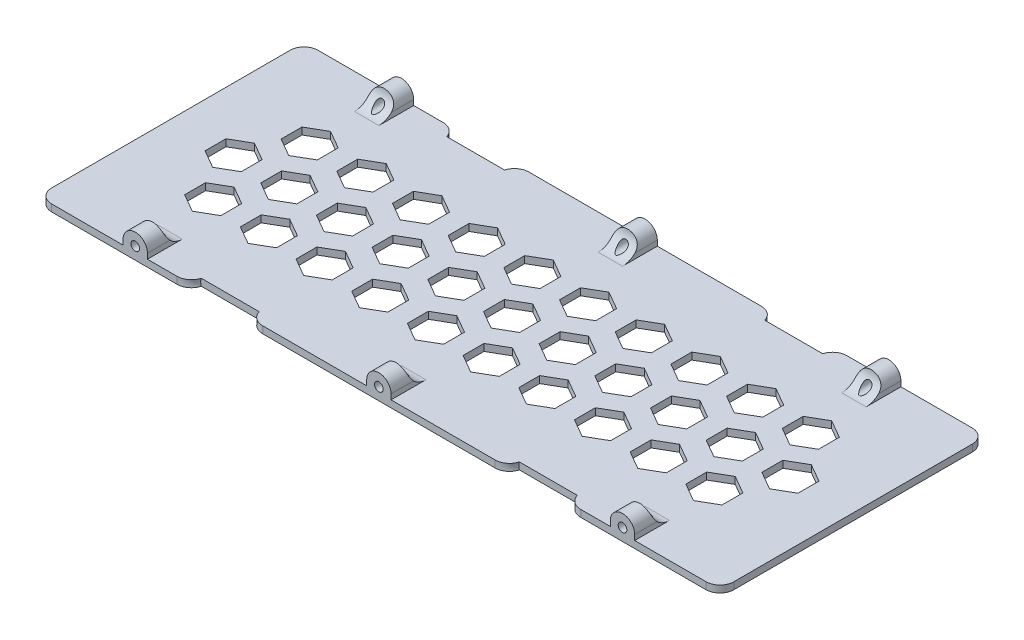
from build123d import *

# Parameters (mm, degrees)
ESQUISSE1_W                                   = 196
ESQUISSE1_H                                   = 76.5
BOSS_EXTRU_1_DEPTH                            = 2
BOSS_EXTRU_2_DEPTH                            = 5
CONG_1_R                                      = 5
TROU_POUR_TARAUDAGE_POUR_TROU_TARAUD_M3_D     = 2.5
TROU_POUR_TARAUDAGE_POUR_TROU_TARAUD_M3_DEPTH = 10.001
R_P_TITION_START                              = 33.250000679
R_P_TITION_LIN_AIRE1_OUTLINE_R                = 1.25
R_P_TITION_LIN_AIRE1_DEPTH                    = 4.999999321
R_P_TITION_START_2                            = 28.2499999
R_P_TITION_LIN_AIRE1_2_OUTLINE_R              = 1.25
R_P_TITION_LIN_AIRE1_2_DEPTH                  = 5.000000779
R_P_TITION_LIN_AIRE1_3_OUTLINE_W              = 5
R_P_TITION_LIN_AIRE1_3_OUTLINE_H              = 7.00000097
ENL_V_MAT_EXTRU_1_DEPTH                       = 3
SYM_TRIE1_START                               = -38.25
SYM_TRIE1_DEPTH                               = 3
SYM_TRIE1_2_OUTLINE_R                         = 1.25
SYM_TRIE1_2_DEPTH                             = 4.999999321
SYM_TRIE1_START_2                             = -33.250000679
SYM_TRIE1_3_OUTLINE_R                         = 1.25
SYM_TRIE1_3_DEPTH                             = 5.000000679
SYM_TRIE1_4_OUTLINE_W                         = 5
SYM_TRIE1_4_OUTLINE_H                         = 7.00000097
CONG_3_R                                      = 4
R_P_TITION_DANS_UNE_ZONE2_DEPTH               = 2


with BuildPart() as part:
    # Esquisse1 → Boss.-Extru.1 (new body)
    with BuildSketch(Plane(origin=(0, 0, 0), x_dir=(1, 0, 0), z_dir=(0, 1, 0))):
        Rectangle(ESQUISSE1_W, ESQUISSE1_H)
    extrude(amount=BOSS_EXTRU_1_DEPTH)

    # Esquisse2 → Boss.-Extru.2 (add)
    with BuildSketch(Plane.XY.offset(38.25)):
        with BuildLine():
            Line((-3.5, 2), (-3.5, 3.5))
            ThreePointArc((-3.5, 3.5), (0, 7), (3.5, 3.5))
            Line((3.5, 3.5), (3.5, 2))
            Line((3.5, 2), (-3.5, 2))
        make_face()
    extrude(amount=-BOSS_EXTRU_2_DEPTH)

    # Congé1
    cong_1_edges = [part.edges().sort_by_distance(p)[0] for p in [
        (0, 2, 33.25),
    ]]
    fillet(cong_1_edges, radius=CONG_1_R - 0.0001)  # a hair under: the kernel refuses the full size

    # Trou pour taraudage pour trou taraudé M3x0.51
    with Locations(Plane(origin=(0, 3.5, 38.25), x_dir=(1, 0, 0), z_dir=(0, 0, 1))):
        with Locations((0, 0)):
            Hole(TROU_POUR_TARAUDAGE_POUR_TROU_TARAUD_M3_D / 2, depth=TROU_POUR_TARAUDAGE_POUR_TROU_TARAUD_M3_DEPTH)

    # Répétition linéaire1: read off the stored shape, not the designer's step
    # Répétition linéaire1 outline → Répétition linéaire1 (add)
    # profile 1 of 2: a face of its own
    with BuildSketch(Plane.XY.offset(R_P_TITION_START)):
        with BuildLine():
            ThreePointArc((-66.5, 3.5), (-70, 7), (-73.5, 3.5))
            Line((-73.5, 3.5), (-73.5, 2))
            Line((-73.5, 2), (-66.5, 2))
            Line((-66.5, 2), (-66.5, 3.5))
        make_face()
        with Locations((-70, 3.5)):
            Circle(R_P_TITION_LIN_AIRE1_OUTLINE_R, mode=Mode.SUBTRACT)
    # profile 2 of 2: a face of its own
    with BuildSketch(Plane.XY.offset(R_P_TITION_START)):
        with BuildLine():
            Line((66.5, 3.5), (66.5, 2))
            Line((66.5, 2), (73.5, 2))
            Line((73.5, 2), (73.5, 3.5))
            ThreePointArc((73.5, 3.5), (70, 7), (66.5, 3.5))
        make_face()
        with Locations((70, 3.5)):
            Circle(R_P_TITION_LIN_AIRE1_OUTLINE_R, mode=Mode.SUBTRACT)
    extrude(amount=R_P_TITION_LIN_AIRE1_DEPTH)

    # R_p_tition lin_aire1 2 outline → R_p_tition lin_aire1 2 (add)
    # profile 1 of 2: a face of its own
    with BuildSketch(Plane.XY.offset(R_P_TITION_START_2)):
        with BuildLine():
            ThreePointArc((-66.5, 3.5), (-70, 7), (-73.5, 3.5))
            Line((-73.5, 3.5), (-73.5, 2))
            Line((-73.5, 2), (-66.5, 2))
            Line((-66.5, 2), (-66.5, 3.5))
        make_face()
        with Locations((-70, 3.5)):
            Circle(R_P_TITION_LIN_AIRE1_2_OUTLINE_R, mode=Mode.SUBTRACT)
    # profile 2 of 2: a face of its own
    with BuildSketch(Plane.XY.offset(R_P_TITION_START_2)):
        with BuildLine():
            Line((66.5, 3.5), (66.5, 2))
            Line((66.5, 2), (73.5, 2))
            Line((73.5, 2), (73.5, 3.5))
            ThreePointArc((73.5, 3.5), (70, 7), (66.5, 3.5))
        make_face()
        with Locations((70, 3.5)):
            Circle(R_P_TITION_LIN_AIRE1_2_OUTLINE_R, mode=Mode.SUBTRACT)
    extrude(amount=R_P_TITION_LIN_AIRE1_2_DEPTH)

    # R_p_tition lin_aire1 3 outline → R_p_tition lin_aire1 3 (revolve, cut)
    with BuildSketch(Plane(origin=(0, 7, 28.25), x_dir=(0, 1, 0), z_dir=(0, 0, -1))):
        with Locations((2.5, -69.999999515)):
            Rectangle(R_P_TITION_LIN_AIRE1_3_OUTLINE_W, R_P_TITION_LIN_AIRE1_3_OUTLINE_H)
        with Locations((2.5, 70.000000485)):
            Rectangle(R_P_TITION_LIN_AIRE1_3_OUTLINE_W, R_P_TITION_LIN_AIRE1_3_OUTLINE_H)
    revolve(axis=Axis((0, 7, 28.25), (1, 0, 0)), mode=Mode.SUBTRACT)

    # Esquisse5 → Enlèv. mat.-Extru.1 (cut)
    with BuildSketch(Plane.XY.offset(38.25)):
        with BuildLine():
            Line((-51.2, 4), (-40.2, 4))
            ThreePointArc((-40.2, 4), (-37.2, 1), (-40.2, -2))
            Line((-40.2, -2), (-51.2, -2))
            ThreePointArc((-51.2, -2), (-54.2, 1), (-51.2, 4))
        make_face()
        with BuildLine():
            Line((51.2, 4), (40.2, 4))
            ThreePointArc((40.2, 4), (37.2, 1), (40.2, -2))
            Line((40.2, -2), (51.2, -2))
            ThreePointArc((51.2, -2), (54.2, 1), (51.2, 4))
        make_face()
    extrude(amount=-ENL_V_MAT_EXTRU_1_DEPTH, mode=Mode.SUBTRACT)

    # Symétrie1: read off the stored shape, not the designer's step
    # Symétrie1 outline → Symétrie1 (cut)
    with BuildSketch(Plane.XY.offset(SYM_TRIE1_START)):
        with BuildLine():
            ThreePointArc((-37.371572875, 0), (-37.2, 1), (-37.371572875, 2))
            Line((-37.371572875, 2), (-54.028427125, 2))
            ThreePointArc((-54.028427125, 2), (-54.2, 1), (-54.028427125, 0))
            Line((-54.028427125, 0), (-37.371572875, 0))
        make_face()
        with BuildLine():
            Line((54.028427125, 2), (37.371572875, 2))
            ThreePointArc((37.371572875, 2), (37.2, 1), (37.371572875, 0))
            Line((37.371572875, 0), (54.028427125, 0))
            ThreePointArc((54.028427125, 0), (54.2, 1), (54.028427125, 2))
        make_face()
    extrude(amount=SYM_TRIE1_DEPTH, mode=Mode.SUBTRACT)

    # Sym_trie1 2 outline → Sym_trie1 2 (add)
    # profile 1 of 3: a face of its own
    with BuildSketch(Plane.XY.offset(SYM_TRIE1_START)):
        with BuildLine():
            Line((66.5, 3.5), (66.5, 2))
            Line((66.5, 2), (73.5, 2))
            Line((73.5, 2), (73.5, 3.5))
            ThreePointArc((73.5, 3.5), (70, 7), (66.5, 3.5))
        make_face()
        with Locations((70, 3.5)):
            Circle(SYM_TRIE1_2_OUTLINE_R, mode=Mode.SUBTRACT)
    # profile 2 of 3: a face of its own
    with BuildSketch(Plane.XY.offset(SYM_TRIE1_START)):
        with BuildLine():
            Line((-73.5, 2), (-66.5, 2))
            Line((-66.5, 2), (-66.5, 3.5))
            ThreePointArc((-66.5, 3.5), (-70, 7), (-73.5, 3.5))
            Line((-73.5, 3.5), (-73.5, 2))
        make_face()
        with Locations((-70, 3.5)):
            Circle(SYM_TRIE1_2_OUTLINE_R, mode=Mode.SUBTRACT)
    # profile 3 of 3: a face of its own
    with BuildSketch(Plane.XY.offset(SYM_TRIE1_START)):
        with BuildLine():
            Line((-3.5, 3.5), (-3.5, 2))
            Line((-3.5, 2), (3.5, 2))
            Line((3.5, 2), (3.5, 3.5))
            ThreePointArc((3.5, 3.5), (0, 7), (-3.5, 3.5))
        make_face()
        with Locations((0, 3.5)):
            Circle(SYM_TRIE1_2_OUTLINE_R, mode=Mode.SUBTRACT)
    extrude(amount=SYM_TRIE1_2_DEPTH)

    # Sym_trie1 3 outline → Sym_trie1 3 (add)
    # profile 1 of 3: a face of its own
    with BuildSketch(Plane.XY.offset(SYM_TRIE1_START_2)):
        with BuildLine():
            Line((66.5, 3.5), (66.5, 2))
            Line((66.5, 2), (73.5, 2))
            Line((73.5, 2), (73.5, 3.5))
            ThreePointArc((73.5, 3.5), (70, 7), (66.5, 3.5))
        make_face()
        with Locations((70, 3.5)):
            Circle(SYM_TRIE1_3_OUTLINE_R, mode=Mode.SUBTRACT)
    # profile 2 of 3: a face of its own
    with BuildSketch(Plane.XY.offset(SYM_TRIE1_START_2)):
        with BuildLine():
            Line((-3.5, 3.5), (-3.5, 2))
            Line((-3.5, 2), (3.5, 2))
            Line((3.5, 2), (3.5, 3.5))
            ThreePointArc((3.5, 3.5), (0, 7), (-3.5, 3.5))
        make_face()
        with Locations((0, 3.5)):
            Circle(SYM_TRIE1_3_OUTLINE_R, mode=Mode.SUBTRACT)
    # profile 3 of 3: a face of its own
    with BuildSketch(Plane.XY.offset(SYM_TRIE1_START_2)):
        with BuildLine():
            Line((-73.5, 2), (-66.5, 2))
            Line((-66.5, 2), (-66.5, 3.5))
            ThreePointArc((-66.5, 3.5), (-70, 7), (-73.5, 3.5))
            Line((-73.5, 3.5), (-73.5, 2))
        make_face()
        with Locations((-70, 3.5)):
            Circle(SYM_TRIE1_3_OUTLINE_R, mode=Mode.SUBTRACT)
    extrude(amount=SYM_TRIE1_3_DEPTH)

    # Sym_trie1 4 outline → Sym_trie1 4 (revolve, cut)
    with BuildSketch(Plane(origin=(0, 7, -28.25), x_dir=(0, 1, 0), z_dir=(0, 0, -1))):
        with Locations((2.5, -4.85e-07)):
            Rectangle(SYM_TRIE1_4_OUTLINE_W, SYM_TRIE1_4_OUTLINE_H)
        with Locations((2.5, -70.000000485)):
            Rectangle(SYM_TRIE1_4_OUTLINE_W, SYM_TRIE1_4_OUTLINE_H)
        with Locations((2.5, 69.999999515)):
            Rectangle(SYM_TRIE1_4_OUTLINE_W, SYM_TRIE1_4_OUTLINE_H)
    revolve(axis=Axis((0, 7, -28.25), (1, 0, 0)), mode=Mode.SUBTRACT)

    # Congé3
    # the kernel refuses this fillet: 4 mm, written as the material it takes off along each edge
    with BuildSketch(Plane(origin=(98, -10, 38.25), x_dir=(-1, 0, 0), z_dir=(0, 1, 0)), Plane(origin=(98, -10, -38.25), x_dir=(0, 0, 1), z_dir=(0, 1, 0))) as cong_3_piece_1:
        with BuildLine():
            CenterArc((CONG_3_R, -CONG_3_R), CONG_3_R, 90, 90)
            Line((0, -CONG_3_R), (-CONG_3_R * 0.02, -CONG_3_R))
            Line((-CONG_3_R * 0.02, -CONG_3_R), (-CONG_3_R * 0.02, CONG_3_R * 0.02))
            Line((-CONG_3_R * 0.02, CONG_3_R * 0.02), (CONG_3_R, CONG_3_R * 0.02))
            Line((CONG_3_R, CONG_3_R * 0.02), (CONG_3_R, 0))
        make_face()
    extrude(amount=22, mode=Mode.SUBTRACT)
    with BuildSketch(Plane(origin=(-98, -10, 38.25), x_dir=(1, 0, 0), z_dir=(0, 1, 0)), Plane(origin=(-98, -10, -38.25), x_dir=(0, 0, 1), z_dir=(0, 1, 0))) as cong_3_piece_2:
        with BuildLine():
            CenterArc((CONG_3_R, CONG_3_R), CONG_3_R, 180, 90)
            Line((0, CONG_3_R), (-CONG_3_R * 0.02, CONG_3_R))
            Line((-CONG_3_R * 0.02, CONG_3_R), (-CONG_3_R * 0.02, -CONG_3_R * 0.02))
            Line((-CONG_3_R * 0.02, -CONG_3_R * 0.02), (CONG_3_R, -CONG_3_R * 0.02))
            Line((CONG_3_R, -CONG_3_R * 0.02), (CONG_3_R, 0))
        make_face()
    extrude(amount=22, mode=Mode.SUBTRACT)
    with BuildSketch(Plane(origin=(-51.2, 1, 38.25), x_dir=(0.9999950652018582, -0.0031415874858796338, 0), z_dir=(0.0031415874858796338, 0.9999950652018582, 0))) as cong_3_piece_3:
        with BuildLine():
            CenterArc((6.872983346, 4), CONG_3_R, 194.477512186, 75.522487814)
            Line((6.872983346, 0), (6.872983346, -0.08))
            Line((6.872983346, -0.08), (3, -0.08))
            Line((3, -0.08), (2.92, 0))
            ThreePointArc((2.92, 0), (2.92, 1.5), (2.922540333, 2.98))
            Line((2.922540333, 2.98), (3, 3))
        make_face()
    revolve(axis=Axis((-51.2, 1, 38.25), (0, 0, -1)), revolution_arc=359.64, mode=Mode.SUBTRACT)
    with BuildSketch(Plane(origin=(-40.2, 1, 38.25), x_dir=(-0.9999950652018582, 0.0031415874858632025, 0), z_dir=(-0.0031415874858632025, -0.9999950652018582, 0))) as cong_3_piece_4:
        with BuildLine():
            CenterArc((6.872983346, 4), CONG_3_R, 194.477512186, 75.522487814)
            Line((3, 3), (2.922540333, 2.98))
            ThreePointArc((2.922540333, 2.98), (2.92, 1.5), (2.92, 0))
            Line((2.92, 0), (3, -0.08))
            Line((3, -0.08), (6.872983346, -0.08))
            Line((6.872983346, -0.08), (6.872983346, 0))
        make_face()
    revolve(axis=Axis((-40.2, 1, 38.25), (0, 0, -1)), revolution_arc=359.64, mode=Mode.SUBTRACT)
    with BuildSketch(Plane(origin=(51.2, 1, 38.25), x_dir=(-0.9999950652018582, -0.0031415874858634245, 0), z_dir=(-0.0031415874858634245, 0.9999950652018582, 0))) as cong_3_piece_5:
        with BuildLine():
            CenterArc((6.872983346, -4), CONG_3_R, 90, 75.522487814)
            Line((6.872983346, 0), (6.872983346, 0.08))
            Line((6.872983346, 0.08), (3, 0.08))
            Line((3, 0.08), (2.92, 0))
            ThreePointArc((2.92, 0), (2.92, -1.5), (2.922540333, -2.98))
            Line((2.922540333, -2.98), (3, -3))
        make_face()
    revolve(axis=Axis((51.2, 1, 38.25), (0, 0, 1)), revolution_arc=359.64, mode=Mode.SUBTRACT)
    with BuildSketch(Plane(origin=(40.2, 1, 38.25), x_dir=(0.9999950652018582, 0.0031415874858634245, 0), z_dir=(0.0031415874858634245, -0.9999950652018582, 0))) as cong_3_piece_6:
        with BuildLine():
            CenterArc((6.872983346, -4), CONG_3_R, 90, 75.522487814)
            Line((3, -3), (2.922540333, -2.98))
            ThreePointArc((2.922540333, -2.98), (2.92, -1.5), (2.92, 0))
            Line((2.92, 0), (3, 0.08))
            Line((3, 0.08), (6.872983346, 0.08))
            Line((6.872983346, 0.08), (6.872983346, 0))
        make_face()
    revolve(axis=Axis((40.2, 1, 38.25), (0, 0, 1)), revolution_arc=359.64, mode=Mode.SUBTRACT)
    with BuildSketch(Plane(origin=(-51.199999996, 1, -38.25), x_dir=(0.9999950652018582, 0.0031415874858799035, 0), z_dir=(0.0031415874858799035, -0.9999950652018582, 0))) as cong_3_piece_7:
        with BuildLine():
            CenterArc((6.87298335, 4), CONG_3_R, 194.477512186, 75.522487814)
            Line((3.000000004, 3), (2.922540337, 2.98))
            ThreePointArc((2.922540337, 2.98), (2.920000004, 1.5), (2.920000004, 0))
            Line((2.920000004, 0), (3.000000004, -0.08))
            Line((3.000000004, -0.08), (6.87298335, -0.08))
            Line((6.87298335, -0.08), (6.87298335, 0))
        make_face()
    revolve(axis=Axis((-51.199999996, 1, -38.25), (0, 0, 1)), revolution_arc=359.64, mode=Mode.SUBTRACT)
    with BuildSketch(Plane(origin=(-40.200000004, 1, -38.25), x_dir=(-0.9999950652018582, -0.0031415874858795995, 0), z_dir=(-0.0031415874858795995, 0.9999950652018582, 0))) as cong_3_piece_8:
        with BuildLine():
            CenterArc((6.87298335, 4), CONG_3_R, 194.477512186, 75.522487814)
            Line((3.000000004, 3), (2.922540337, 2.98))
            ThreePointArc((2.922540337, 2.98), (2.920000004, 1.5), (2.920000004, 0))
            Line((2.920000004, 0), (3.000000004, -0.08))
            Line((3.000000004, -0.08), (6.87298335, -0.08))
            Line((6.87298335, -0.08), (6.87298335, 0))
        make_face()
    revolve(axis=Axis((-40.200000004, 1, -38.25), (0, 0, 1)), revolution_arc=359.64, mode=Mode.SUBTRACT)
    with BuildSketch(Plane(origin=(51.199999996, 1, -38.25), x_dir=(-0.9999950652018582, -0.0031415874858799404, 0), z_dir=(-0.0031415874858799404, 0.9999950652018582, 0))) as cong_3_piece_9:
        with BuildLine():
            CenterArc((6.87298335, 4), CONG_3_R, 194.477512186, 75.522487814)
            Line((3.000000004, 3), (2.922540337, 2.98))
            ThreePointArc((2.922540337, 2.98), (2.920000004, 1.5), (2.920000004, 0))
            Line((2.920000004, 0), (3.000000004, -0.08))
            Line((3.000000004, -0.08), (6.87298335, -0.08))
            Line((6.87298335, -0.08), (6.87298335, 0))
        make_face()
    revolve(axis=Axis((51.199999996, 1, -38.25), (0, 0, 1)), revolution_arc=359.64, mode=Mode.SUBTRACT)
    with BuildSketch(Plane(origin=(40.200000004, 1, -38.25), x_dir=(0.9999950652018582, 0.0031415874858796364, 0), z_dir=(0.0031415874858796364, -0.9999950652018582, 0))) as cong_3_piece_10:
        with BuildLine():
            CenterArc((6.87298335, 4), CONG_3_R, 194.477512186, 75.522487814)
            Line((6.87298335, 0), (6.87298335, -0.08))
            Line((6.87298335, -0.08), (3.000000004, -0.08))
            Line((3.000000004, -0.08), (2.920000004, 0))
            ThreePointArc((2.920000004, 0), (2.920000004, 1.5), (2.922540337, 2.98))
            Line((2.922540337, 2.98), (3.000000004, 3))
        make_face()
    revolve(axis=Axis((40.200000004, 1, -38.25), (0, 0, 1)), revolution_arc=359.64, mode=Mode.SUBTRACT)

    # Répétition dans une zone2: read off the stored shape, not the designer's step
    # Répétition dans une zone2 outline → Répétition dans une zone2 (cut)
    with BuildSketch(Plane(origin=(0, 0, 0), x_dir=(1, 0, 0), z_dir=(0, 1, 0))):
        Polygon((-56, 7.856406461), (-50.803847577, 10.856406461), (-50.803847577, 16.856406461), (-56, 19.856406461), (-61.196152423, 16.856406461), (-61.196152423, 10.856406461), align=None)
        Polygon((-80, -6), (-74.803847577, -3), (-74.803847577, 3), (-80, 6), (-85.196152423, 3), (-85.196152423, -3), align=None)
        Polygon((-50.803847577, -16.856406461), (-50.803847577, -10.856406461), (-56, -7.856406461), (-61.196152423, -10.856406461), (-61.196152423, -16.856406461), (-56, -19.856406461), align=None)
        Polygon((-26.803847577, 3), (-32, 6), (-37.196152423, 3), (-37.196152423, -3), (-32, -6), (-26.803847577, -3), align=None)
        Polygon((-2.803847577, -10.856406461), (-8, -7.856406461), (-13.196152423, -10.856406461), (-13.196152423, -16.856406461), (-8, -19.856406461), (-2.803847577, -16.856406461), align=None)
        Polygon((32, -6), (37.196152423, -3), (37.196152423, 3), (32, 6), (26.803847577, 3), (26.803847577, -3), align=None)
        Polygon((8, -19.856406461), (13.196152423, -16.856406461), (13.196152423, -10.856406461), (8, -7.856406461), (2.803847577, -10.856406461), (2.803847577, -16.856406461), align=None)
        Polygon((56, 7.856406461), (61.196152423, 10.856406461), (61.196152423, 16.856406461), (56, 19.856406461), (50.803847577, 16.856406461), (50.803847577, 10.856406461), align=None)
        Polygon((61.196152423, -10.856406461), (56, -7.856406461), (50.803847577, -10.856406461), (50.803847577, -16.856406461), (56, -19.856406461), (61.196152423, -16.856406461), align=None)
        Polygon((13.196152423, 16.856406461), (8, 19.856406461), (2.803847577, 16.856406461), (2.803847577, 10.856406461), (8, 7.856406461), (13.196152423, 10.856406461), align=None)
        Polygon((48, -6), (53.196152423, -3), (53.196152423, 3), (48, 6), (42.803847577, 3), (42.803847577, -3), align=None)
        Polygon((24, -19.856406461), (29.196152423, -16.856406461), (29.196152423, -10.856406461), (24, -7.856406461), (18.803847577, -10.856406461), (18.803847577, -16.856406461), align=None)
        Polygon((72, 7.856406461), (77.196152423, 10.856406461), (77.196152423, 16.856406461), (72, 19.856406461), (66.803847577, 16.856406461), (66.803847577, 10.856406461), align=None)
        Polygon((77.196152423, -10.856406461), (72, -7.856406461), (66.803847577, -10.856406461), (66.803847577, -16.856406461), (72, -19.856406461), (77.196152423, -16.856406461), align=None)
        Polygon((29.196152423, 16.856406461), (24, 19.856406461), (18.803847577, 16.856406461), (18.803847577, 10.856406461), (24, 7.856406461), (29.196152423, 10.856406461), align=None)
        Polygon((64, -6), (69.196152423, -3), (69.196152423, 3), (64, 6), (58.803847577, 3), (58.803847577, -3), align=None)
        Polygon((40, -19.856406461), (45.196152423, -16.856406461), (45.196152423, -10.856406461), (40, -7.856406461), (34.803847577, -10.856406461), (34.803847577, -16.856406461), align=None)
        Polygon((45.196152423, 16.856406461), (40, 19.856406461), (34.803847577, 16.856406461), (34.803847577, 10.856406461), (40, 7.856406461), (45.196152423, 10.856406461), align=None)
        Polygon((-8, 7.856406461), (-2.803847577, 10.856406461), (-2.803847577, 16.856406461), (-8, 19.856406461), (-13.196152423, 16.856406461), (-13.196152423, 10.856406461), align=None)
        Polygon((5.196152423, 3), (0, 6), (-5.196152423, 3), (-5.196152423, -3), (0, -6), (5.196152423, -3), align=None)
        Polygon((-18.803847577, 16.856406461), (-24, 19.856406461), (-29.196152423, 16.856406461), (-29.196152423, 10.856406461), (-24, 7.856406461), (-18.803847577, 10.856406461), align=None)
        Polygon((-24, -19.856406461), (-18.803847577, -16.856406461), (-18.803847577, -10.856406461), (-24, -7.856406461), (-29.196152423, -10.856406461), (-29.196152423, -16.856406461), align=None)
        Polygon((-16, -6), (-10.803847577, -3), (-10.803847577, 3), (-16, 6), (-21.196152423, 3), (-21.196152423, -3), align=None)
        Polygon((-40, -19.856406461), (-34.803847577, -16.856406461), (-34.803847577, -10.856406461), (-40, -7.856406461), (-45.196152423, -10.856406461), (-45.196152423, -16.856406461), align=None)
        Polygon((-34.803847577, 16.856406461), (-40, 19.856406461), (-45.196152423, 16.856406461), (-45.196152423, 10.856406461), (-40, 7.856406461), (-34.803847577, 10.856406461), align=None)
        Polygon((-42.803847577, 3), (-48, 6), (-53.196152423, 3), (-53.196152423, -3), (-48, -6), (-42.803847577, -3), align=None)
        Polygon((-66.803847577, 16.856406461), (-72, 19.856406461), (-77.196152423, 16.856406461), (-77.196152423, 10.856406461), (-72, 7.856406461), (-66.803847577, 10.856406461), align=None)
        Polygon((16, -6), (21.196152423, -3), (21.196152423, 3), (16, 6), (10.803847577, 3), (10.803847577, -3), align=None)
        Polygon((80, -6), (85.196152423, -3), (85.196152423, 3), (80, 6), (74.803847577, 3), (74.803847577, -3), align=None)
        Polygon((-72, -19.856406461), (-66.803847577, -16.856406461), (-66.803847577, -10.856406461), (-72, -7.856406461), (-77.196152423, -10.856406461), (-77.196152423, -16.856406461), align=None)
        Polygon((-64, -6), (-58.803847577, -3), (-58.803847577, 3), (-64, 6), (-69.196152423, 3), (-69.196152423, -3), align=None)
    extrude(amount=R_P_TITION_DANS_UNE_ZONE2_DEPTH, mode=Mode.SUBTRACT)


solid = part.part
